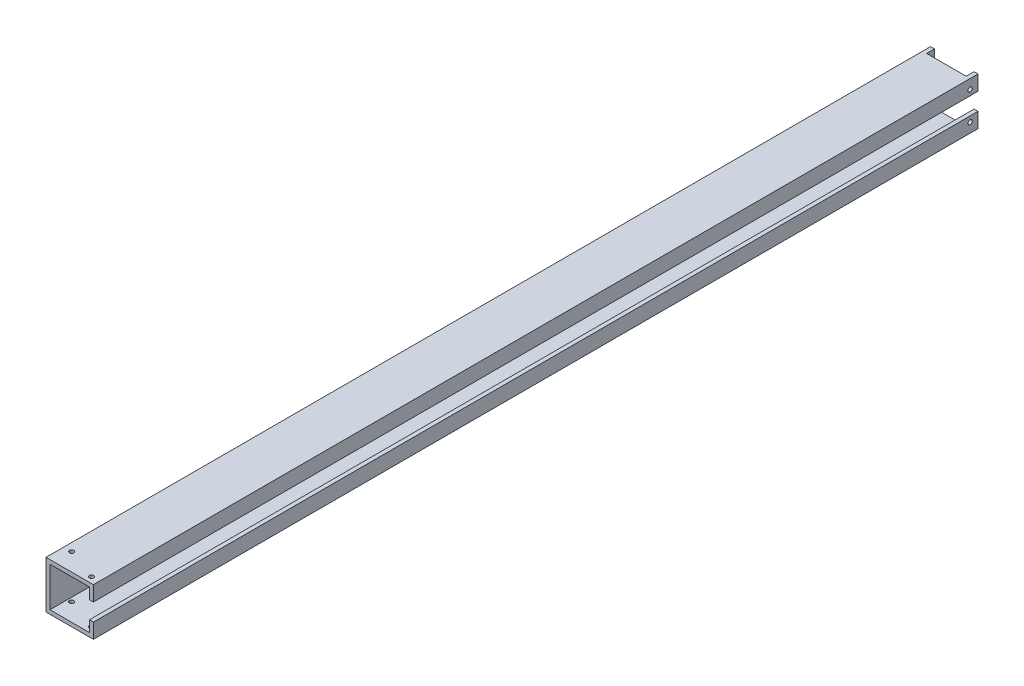
from build123d import *

# Parameters (mm, degrees)
BOSS_EXTRUDE1_DEPTH     = 711.2
CUT_EXTRUDE2_DEPTH      = 70.104
CUT_EXTRUDE2_DEPTH_BACK = 58.42
SKETCH7_R               = 1.75
SKETCH8_W               = 31.75
SKETCH8_H               = 12.7
CUT_EXTRUDE3_DEPTH      = 71.882
SKETCH9_R               = 1.75
CUT_EXTRUDE4_DEPTH      = 68.326


with BuildPart() as part:
    # Sketch1 → Boss-Extrude1 (new body)
    with BuildSketch(Plane(origin=(0, 0, 0), x_dir=(0, 1, 0), z_dir=(0, 0, 1))):
        Polygon((6.985, -19.05), (19.05, -19.05), (19.05, 19.05), (-19.05, 19.05), (-19.05, -19.05), (-6.985, -19.05), (-6.985, -15.875), (-15.875, -15.875), (-15.875, 15.875), (15.875, 15.875), (15.875, -15.875), (6.985, -15.875), align=None)
    extrude(amount=BOSS_EXTRUDE1_DEPTH)

    # Sketch7 → Cut-Extrude2 (cut, two sides: drawn at the far end of the back side and taken through both)
    with BuildSketch(Plane(origin=(0, 0, 0), x_dir=(-1, 0, 0), z_dir=(0, 1, 0)).offset(-CUT_EXTRUDE2_DEPTH_BACK)):
        with Locations((-12.7, 706.4375)):
            Circle(SKETCH7_R)
        with Locations((12.7, 696.9125)):
            Circle(SKETCH7_R)
    extrude(amount=CUT_EXTRUDE2_DEPTH + CUT_EXTRUDE2_DEPTH_BACK, mode=Mode.SUBTRACT)

    # Sketch8 → Cut-Extrude3 (cut)
    with BuildSketch(Plane(origin=(0, 19.05, 0), x_dir=(-1, 0, 0), z_dir=(0, 1, 0))):
        Rectangle(SKETCH8_W, SKETCH8_H)
    extrude(amount=-CUT_EXTRUDE3_DEPTH, mode=Mode.SUBTRACT)

    # Sketch9 → Cut-Extrude4 (cut)
    with BuildSketch(Plane.YZ.offset(19.05)):
        with Locations((-11.43, 6.35)):
            Circle(SKETCH9_R)
        with Locations((11.43, 6.35)):
            Circle(SKETCH9_R)
    extrude(amount=-CUT_EXTRUDE4_DEPTH, mode=Mode.SUBTRACT)


solid = part.part
